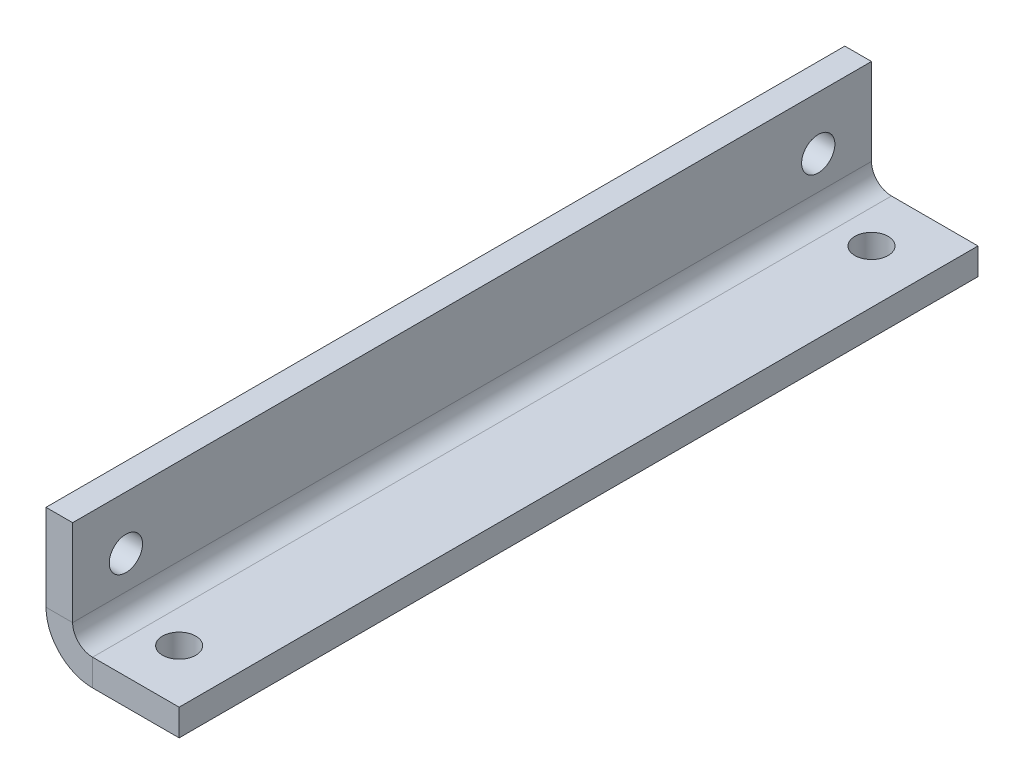
from build123d import *

# Parameters (mm, degrees)
BASE_FLANGE1_DEPTH = 30
M3_TAPPED_HOLE1_D  = 2.5
M3_TAPPED_HOLE2_D  = 2.5


# Sheet-metal steps are written as plain solids
with BuildPart() as part:
    # Sketch1 → Base-Flange1 (new, symmetric)
    with BuildSketch(Plane.XY):
        with BuildLine():
            Line((10, 0), (3.5, 0))
            ThreePointArc((3.5, 0), (1.025126266, 1.025126266), (0, 3.5))
            Line((0, 3.5), (0, 10))
            Line((0, 10), (2, 10))
            Line((2, 10), (2, 3.5))
            ThreePointArc((2, 3.5), (2.439339828, 2.439339828), (3.5, 2))
            Line((3.5, 2), (10, 2))
            Line((10, 2), (10, 0))
        make_face()
    extrude(amount=BASE_FLANGE1_DEPTH, both=True)

    # M3 Tapped Hole1 (through all)
    with Locations(Plane(origin=(2, 0, 0), x_dir=(0, 0, -1), z_dir=(1, 0, 0))):
        with Locations((-26, 6), (26, 6)):
            Hole(M3_TAPPED_HOLE1_D / 2)

    # M3 Tapped Hole2 (through all)
    with Locations(Plane(origin=(0, 2, 0), x_dir=(1, 0, 0), z_dir=(0, 1, 0))):
        with Locations((6, -26), (6, 26)):
            Hole(M3_TAPPED_HOLE2_D / 2)


solid = part.part
